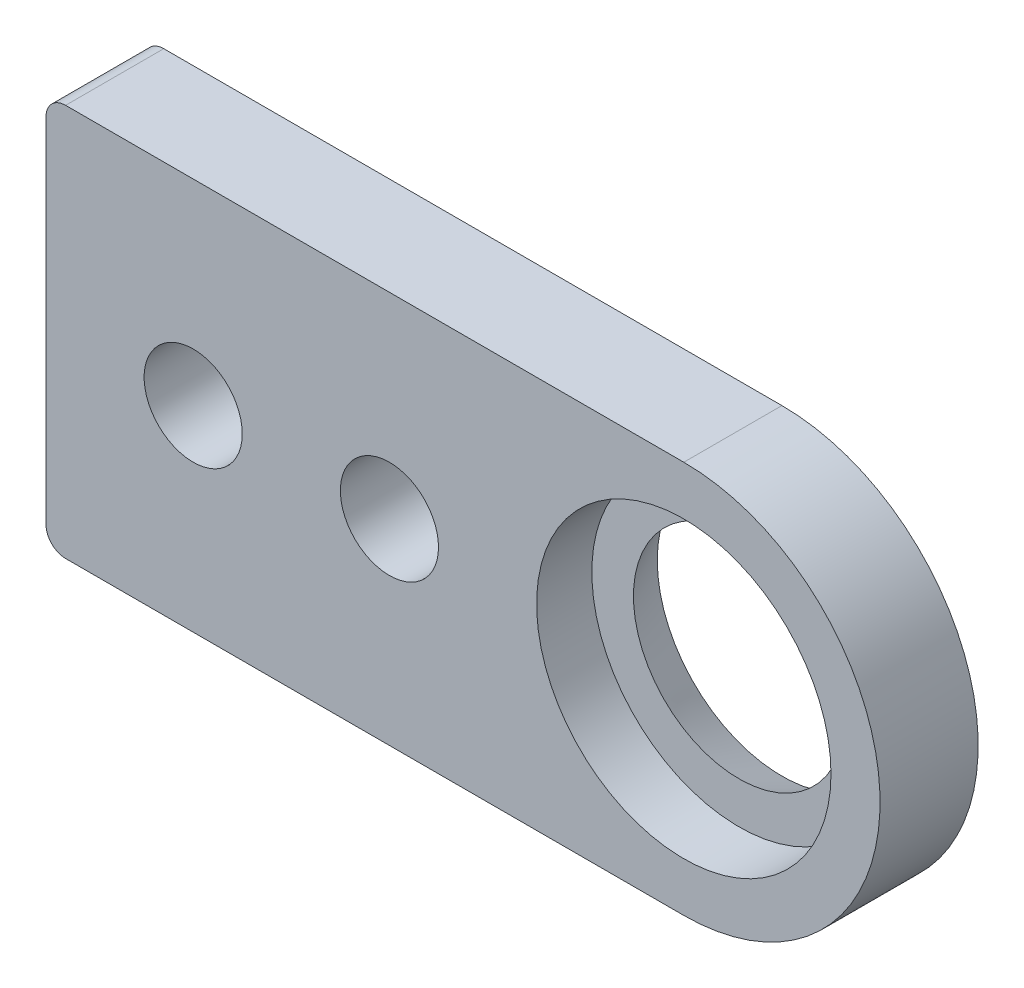
from build123d import *

# Parameters (mm, degrees)
SKETCH1_W           = 53.975
SKETCH1_H           = 25.4
SKETCH1_R           = 9.525
SKETCH1_R_2         = 3.175
BOSS_EXTRUDE2_DEPTH = 6.35
SKETCH1_5_R         = 9.525
SKETCH1_5_R_2       = 6.35
BOSS_EXTRUDE3_DEPTH = 2.778125
FILLET1_R           = 1.27
CUT_EXTRUDE1_DEPTH  = 60.989858518


with BuildPart() as part:
    # Sketch1 → Boss-Extrude2 (new body)
    with BuildSketch(Plane.XY):
        with Locations((26.9875, -12.7)):
            Rectangle(SKETCH1_W, SKETCH1_H)
        with Locations((41.275, -12.7)):
            Circle(SKETCH1_R, mode=Mode.SUBTRACT)
        with Locations((22.225, -12.7)):
            Circle(SKETCH1_R_2, mode=Mode.SUBTRACT)
        with Locations((9.525, -12.7)):
            Circle(SKETCH1_R_2, mode=Mode.SUBTRACT)
    extrude(amount=BOSS_EXTRUDE2_DEPTH)

    # Sketch1<5> → Boss-Extrude3 (add)
    with BuildSketch(Plane.XY):
        with Locations((41.275, -12.7)):
            Circle(SKETCH1_5_R)
        with Locations((41.275, -12.7)):
            Circle(SKETCH1_5_R_2, mode=Mode.SUBTRACT)
    extrude(amount=BOSS_EXTRUDE3_DEPTH)

    # Fillet1
    fillet1_edges = [part.edges().sort_by_distance(p)[0] for p in [
        (0, -25.4, 3.175),
        (0, 0, 3.175),
        (53.975, -25.4, 3.175),
        (53.975, 0, 3.175),
    ]]
    fillet(fillet1_edges, radius=FILLET1_R)

    # Sketch2 → Cut-Extrude1 (cut, through all)
    with BuildSketch(Plane.XY.offset(6.35)):
        with BuildLine():
            Line((41.275, -25.4), (52.705, -25.4))
            ThreePointArc((52.705, -25.4), (53.603025612, -25.028025612), (53.975, -24.13))
            Line((53.975, -24.13), (53.975, -12.7))
            ThreePointArc((53.975, -12.7), (50.255256121, -21.680256121), (41.275, -25.4))
        make_face()
        with BuildLine():
            ThreePointArc((41.275, 0), (50.255256121, -3.719743879), (53.975, -12.7))
            Line((53.975, -12.7), (53.975, -1.27))
            ThreePointArc((53.975, -1.27), (53.603025612, -0.371974388), (52.705, 0))
            Line((52.705, 0), (41.275, 0))
        make_face()
    extrude(amount=-CUT_EXTRUDE1_DEPTH, mode=Mode.SUBTRACT)

    # Sketch3 → Cut-Revolve3 (revolve, cut)
    with BuildSketch(Plane(origin=(41.275, 0, 0), x_dir=(0, 0, -1), z_dir=(1, 0, 0))):
        Polygon((-2.778125, -11.10969879), (0, -9.872797848), (0, -4.63178881), (-2.778125, -5.868689752), align=None)
    revolve(axis=Axis((41.275, -12.7, 2.778125), (0, 0, -1)), mode=Mode.SUBTRACT)


solid = part.part
